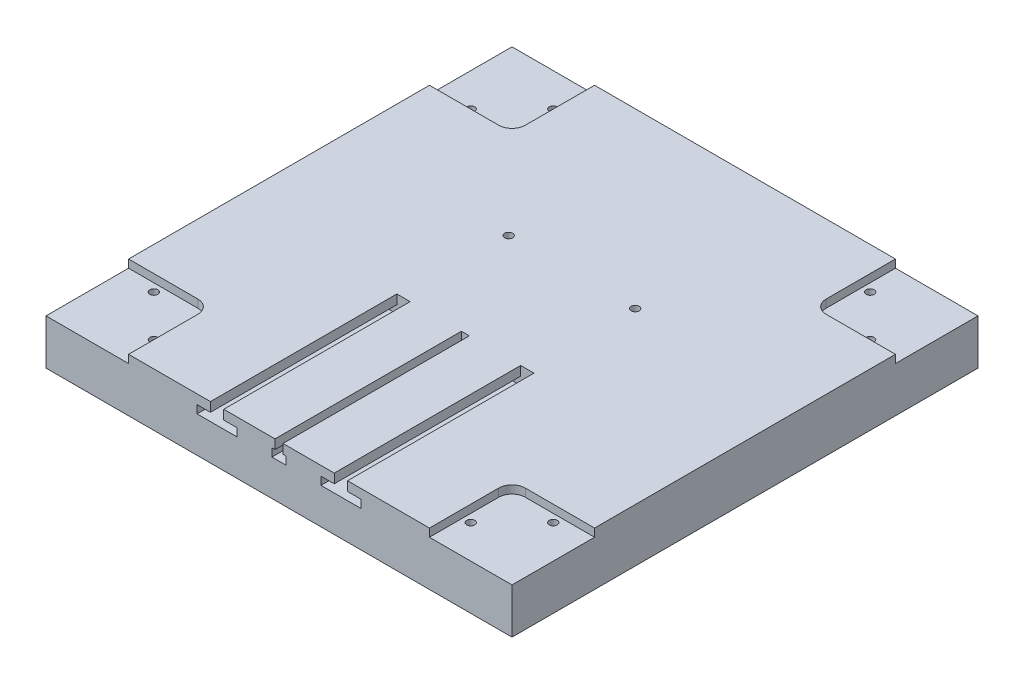
from build123d import *

# Parameters (mm, degrees)
SKETCH1_W           = 175
SKETCH1_H           = 175
BOSS_EXTRUDE2_DEPTH = 20
CUT_EXTRUDE6_DEPTH  = 3
CUT_EXTRUDE7_REACH  = 126.906
SKETCH8_R           = 1.5
CUT_EXTRUDE8_DEPTH  = 70
CUT_EXTRUDE9_REACH  = 127.35
SKETCH10_R          = 1.5


with BuildPart() as part:
    # Sketch1 → Boss-Extrude2 (new body)
    with BuildSketch(Plane(origin=(0, 0, 0), x_dir=(1, 0, 0), z_dir=(0, 1, 0))):
        Rectangle(SKETCH1_W, SKETCH1_H)
    extrude(amount=BOSS_EXTRUDE2_DEPTH)

    # Sketch7 → Cut-Extrude6 (cut)
    with BuildSketch(Plane(origin=(0, 20, 0), x_dir=(1, 0, 0), z_dir=(0, 1, 0))):
        with BuildLine():
            Line((-87.5, 87.5), (-56.5, 87.5))
            Line((-56.5, 87.5), (-56.5, 61.5))
            ThreePointArc((-56.5, 61.5), (-57.964466094, 57.964466094), (-61.5, 56.5))
            Line((-61.5, 56.5), (-87.5, 56.5))
            Line((-87.5, 56.5), (-87.5, 87.5))
        make_face()
        with BuildLine():
            Line((87.5, 56.5), (61.5, 56.5))
            ThreePointArc((61.5, 56.5), (57.964466094, 57.964466094), (56.5, 61.5))
            Line((56.5, 61.5), (56.5, 87.5))
            Line((56.5, 87.5), (87.5, 87.5))
            Line((87.5, 87.5), (87.5, 56.5))
        make_face()
        with BuildLine():
            Line((87.5, -87.5), (87.5, -56.5))
            Line((87.5, -56.5), (61.5, -56.5))
            ThreePointArc((61.5, -56.5), (57.964466094, -57.964466094), (56.5, -61.5))
            Line((56.5, -61.5), (56.5, -87.5))
            Line((56.5, -87.5), (87.5, -87.5))
        make_face()
        with BuildLine():
            Line((-56.5, -87.5), (-56.5, -61.5))
            ThreePointArc((-56.5, -61.5), (-57.964466094, -57.964466094), (-61.5, -56.5))
            Line((-61.5, -56.5), (-87.5, -56.5))
            Line((-87.5, -56.5), (-87.5, -87.5))
            Line((-87.5, -87.5), (-56.5, -87.5))
        make_face()
    extrude(amount=-CUT_EXTRUDE6_DEPTH, mode=Mode.SUBTRACT)

    # Sketch8 → Cut-Extrude7 (cut, up to next)
    with BuildSketch(Plane(origin=(0, 17, 0), x_dir=(1, 0, 0), z_dir=(0, 1, 0)), mode=Mode.PRIVATE) as cut_extrude7_sk1:
        with Locations((-75, -59.5)):
            Circle(SKETCH8_R)
    cut_extrude7_tool1 = extrude(cut_extrude7_sk1.sketch, amount=-CUT_EXTRUDE7_REACH, mode=Mode.PRIVATE) & part.part
    # Sketch8 → Cut-Extrude7 (cut, up to next)
    with BuildSketch(Plane(origin=(0, 17, 0), x_dir=(1, 0, 0), z_dir=(0, 1, 0)), mode=Mode.PRIVATE) as cut_extrude7_sk2:
        with Locations((-59.5, -75)):
            Circle(SKETCH8_R)
    cut_extrude7_tool2 = extrude(cut_extrude7_sk2.sketch, amount=-CUT_EXTRUDE7_REACH, mode=Mode.PRIVATE) & part.part
    # Sketch8 → Cut-Extrude7 (cut, up to next)
    with BuildSketch(Plane(origin=(0, 17, 0), x_dir=(1, 0, 0), z_dir=(0, 1, 0)), mode=Mode.PRIVATE) as cut_extrude7_sk3:
        with Locations((59.5, -75)):
            Circle(SKETCH8_R)
    cut_extrude7_tool3 = extrude(cut_extrude7_sk3.sketch, amount=-CUT_EXTRUDE7_REACH, mode=Mode.PRIVATE) & part.part
    # Sketch8 → Cut-Extrude7 (cut, up to next)
    with BuildSketch(Plane(origin=(0, 17, 0), x_dir=(1, 0, 0), z_dir=(0, 1, 0)), mode=Mode.PRIVATE) as cut_extrude7_sk4:
        with Locations((75, -59.5)):
            Circle(SKETCH8_R)
    cut_extrude7_tool4 = extrude(cut_extrude7_sk4.sketch, amount=-CUT_EXTRUDE7_REACH, mode=Mode.PRIVATE) & part.part
    # Sketch8 → Cut-Extrude7 (cut, up to next)
    with BuildSketch(Plane(origin=(0, 17, 0), x_dir=(1, 0, 0), z_dir=(0, 1, 0)), mode=Mode.PRIVATE) as cut_extrude7_sk5:
        with Locations((59.5, 75)):
            Circle(SKETCH8_R)
    cut_extrude7_tool5 = extrude(cut_extrude7_sk5.sketch, amount=-CUT_EXTRUDE7_REACH, mode=Mode.PRIVATE) & part.part
    # Sketch8 → Cut-Extrude7 (cut, up to next)
    with BuildSketch(Plane(origin=(0, 17, 0), x_dir=(1, 0, 0), z_dir=(0, 1, 0)), mode=Mode.PRIVATE) as cut_extrude7_sk6:
        with Locations((75, 59.5)):
            Circle(SKETCH8_R)
    cut_extrude7_tool6 = extrude(cut_extrude7_sk6.sketch, amount=-CUT_EXTRUDE7_REACH, mode=Mode.PRIVATE) & part.part
    # Sketch8 → Cut-Extrude7 (cut, up to next)
    with BuildSketch(Plane(origin=(0, 17, 0), x_dir=(1, 0, 0), z_dir=(0, 1, 0)), mode=Mode.PRIVATE) as cut_extrude7_sk7:
        with Locations((-59.5, 75)):
            Circle(SKETCH8_R)
    cut_extrude7_tool7 = extrude(cut_extrude7_sk7.sketch, amount=-CUT_EXTRUDE7_REACH, mode=Mode.PRIVATE) & part.part
    # Sketch8 → Cut-Extrude7 (cut, up to next)
    with BuildSketch(Plane(origin=(0, 17, 0), x_dir=(1, 0, 0), z_dir=(0, 1, 0)), mode=Mode.PRIVATE) as cut_extrude7_sk8:
        with Locations((-75, 59.5)):
            Circle(SKETCH8_R)
    cut_extrude7_tool8 = extrude(cut_extrude7_sk8.sketch, amount=-CUT_EXTRUDE7_REACH, mode=Mode.PRIVATE) & part.part
    add(cut_extrude7_tool1.solids().sort_by_distance((-75, 17, 59.5))[0], mode=Mode.SUBTRACT)
    add(cut_extrude7_tool2.solids().sort_by_distance((-59.5, 17, 75))[0], mode=Mode.SUBTRACT)
    add(cut_extrude7_tool3.solids().sort_by_distance((59.5, 17, 75))[0], mode=Mode.SUBTRACT)
    add(cut_extrude7_tool4.solids().sort_by_distance((75, 17, 59.5))[0], mode=Mode.SUBTRACT)
    add(cut_extrude7_tool5.solids().sort_by_distance((59.5, 17, -75))[0], mode=Mode.SUBTRACT)
    add(cut_extrude7_tool6.solids().sort_by_distance((75, 17, -59.5))[0], mode=Mode.SUBTRACT)
    add(cut_extrude7_tool7.solids().sort_by_distance((-59.5, 17, -75))[0], mode=Mode.SUBTRACT)
    add(cut_extrude7_tool8.solids().sort_by_distance((-75, 17, -59.5))[0], mode=Mode.SUBTRACT)

    # Sketch9 → Cut-Extrude8 (cut)
    with BuildSketch(Plane.XY.offset(87.5)):
        Polygon((-20.75, 20), (-25.75, 20), (-25.75, 16.5), (-30.75, 16.5), (-30.75, 13.5), (-15.75, 13.5), (-15.75, 16.5), (-20.75, 16.5), align=None)
        Polygon((1.5, 20), (-1.5, 20), (-1.5, 16.5), (-2.65, 16.5), (-2.65, 13.5), (2.65, 13.5), (2.65, 16.5), (1.5, 16.5), align=None)
        Polygon((25.75, 16.5), (25.75, 20), (20.75, 20), (20.75, 16.5), (15.75, 16.5), (15.75, 13.5), (30.75, 13.5), (30.75, 16.5), align=None)
    extrude(amount=-CUT_EXTRUDE8_DEPTH, mode=Mode.SUBTRACT)

    # Sketch10 → Cut-Extrude9 (cut, up to next)
    with BuildSketch(Plane(origin=(0, 20, 0), x_dir=(1, 0, 0), z_dir=(0, 1, 0)), mode=Mode.PRIVATE) as cut_extrude9_sk1:
        with Locations((-23.75, 22.5)):
            Circle(SKETCH10_R)
    cut_extrude9_tool1 = extrude(cut_extrude9_sk1.sketch, amount=-CUT_EXTRUDE9_REACH, mode=Mode.PRIVATE) & part.part
    # Sketch10 → Cut-Extrude9 (cut, up to next)
    with BuildSketch(Plane(origin=(0, 20, 0), x_dir=(1, 0, 0), z_dir=(0, 1, 0)), mode=Mode.PRIVATE) as cut_extrude9_sk2:
        with Locations((23.75, 22.5)):
            Circle(SKETCH10_R)
    cut_extrude9_tool2 = extrude(cut_extrude9_sk2.sketch, amount=-CUT_EXTRUDE9_REACH, mode=Mode.PRIVATE) & part.part
    add(cut_extrude9_tool1.solids().sort_by_distance((-23.75, 20, -22.5))[0], mode=Mode.SUBTRACT)
    add(cut_extrude9_tool2.solids().sort_by_distance((23.75, 20, -22.5))[0], mode=Mode.SUBTRACT)


solid = part.part
